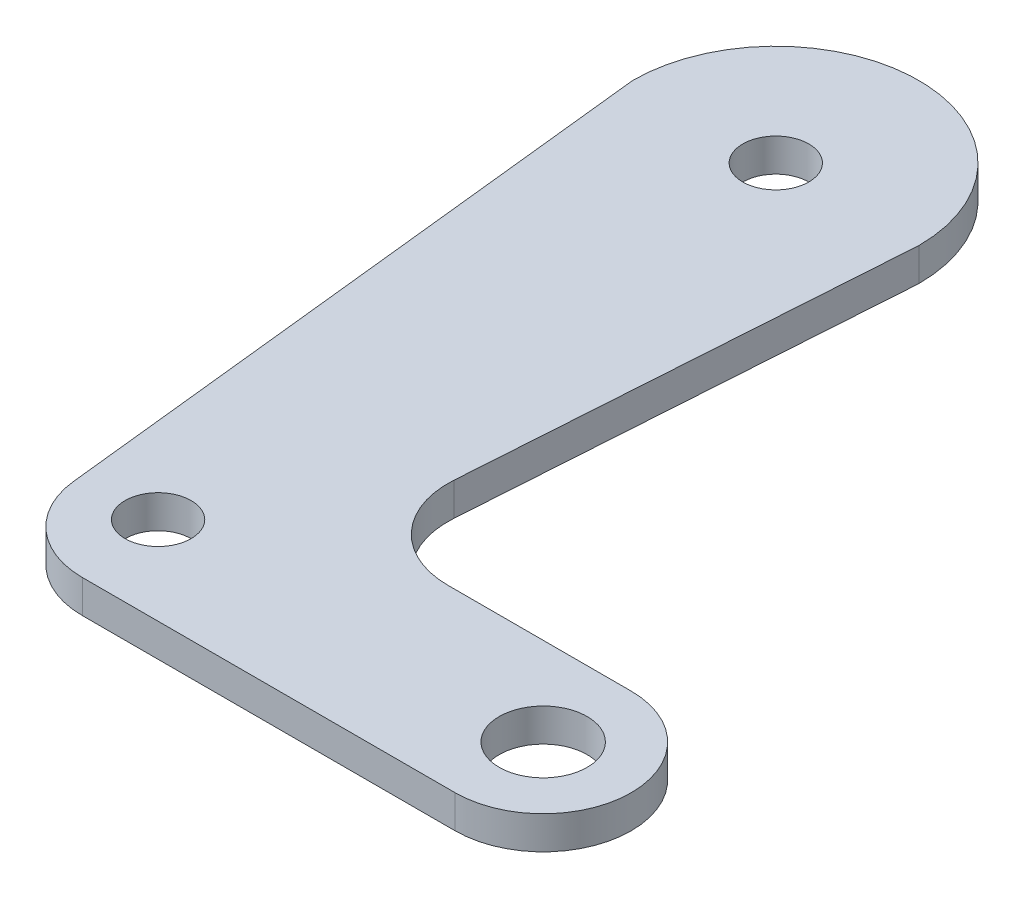
from build123d import *

# Parameters (mm, degrees)
SCHIZZO1_R          = 3
SCHIZZO1_R_2        = 4
BASE_FLANGIA1_DEPTH = 3


# Sheet-metal steps are written as plain solids
with BuildPart() as part:
    # Schizzo1 → Base-Flangia1 (new body)
    with BuildSketch(Plane(origin=(0, 0, 0), x_dir=(1, 0, 0), z_dir=(0, 1, 0))):
        with BuildLine():
            Line((35, -8), (1.108629176, -8))
            ThreePointArc((1.108629176, -8), (-4.235957572, -5.952763433), (-6.845135964, -0.858848123))
            Line((-6.845135964, -0.858848123), (-13, 56.141151877))
            ThreePointArc((-13, 56.141151877), (0, 69.141151877), (13, 56.141151877))
            Line((13, 56.141151877), (10.343642784, 16.535356532))
            ThreePointArc((10.343642784, 16.535356532), (12.48264327, 10.535700057), (18.32570977, 8))
            Line((18.32570977, 8), (35, 8))
            ThreePointArc((35, 8), (43, 0), (35, -8))
        make_face()
        with Locations(Location((0, 0, 0), (0, 0, 270))):
            Circle(SCHIZZO1_R, mode=Mode.SUBTRACT)
        with Locations(Location((35, 0, 0), (0, 0, 270))):
            Circle(SCHIZZO1_R_2, mode=Mode.SUBTRACT)
        with Locations(Location((0, 56.141151877, 0), (0, 0, 270))):
            Circle(SCHIZZO1_R, mode=Mode.SUBTRACT)
    extrude(amount=-BASE_FLANGIA1_DEPTH)


solid = part.part
